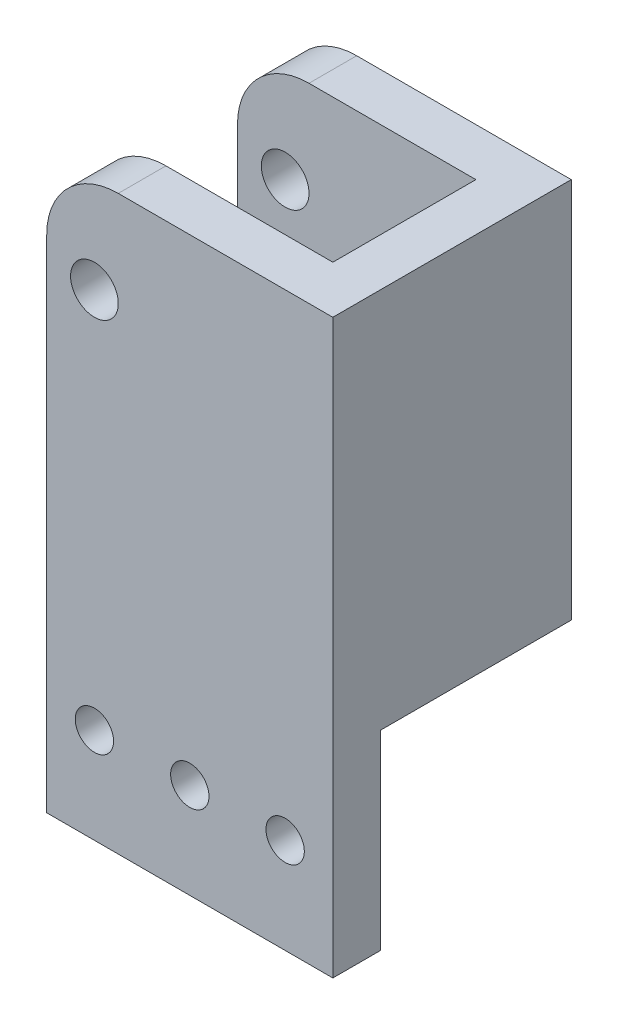
from build123d import *

# Parameters (mm, degrees)
SKETCH1_W                   = 38.1
SKETCH1_H                   = 76.2
BOSS_EXTRUDE1_DEPTH         = 31.75
SKETCH3_W                   = 25.4
SKETCH3_H                   = 76.2
CUT_EXTRUDE2_DEPTH          = 31.75
SKETCH4_W                   = 25.4
SKETCH4_H                   = 25.4
CUT_EXTRUDE3_DEPTH          = 89.44526556
SKETCH5_W                   = 31.75
SKETCH5_H                   = 6.35
BOSS_EXTRUDE2_DEPTH         = 50.8
SKETCH6_R                   = 3.175
CUT_EXTRUDE4_DEPTH          = 50.8
FILLET2_R                   = 9.525
SKETCH7_W                   = 31.75
SKETCH7_H                   = 19.05
BOSS_EXTRUDE3_DEPTH         = 6.35
F_1_4_20_TAPPED_HOLE1_D     = 5.1054
F_1_4_20_TAPPED_HOLE1_DEPTH = 19.05
F_1_4_20_TAPPED_HOLE1_TIP   = 1.533816902


with BuildPart() as part:
    # Sketch1 → Boss-Extrude1 (new body)
    with BuildSketch(Plane.XY):
        with Locations((19.05, 38.1)):
            Rectangle(SKETCH1_W, SKETCH1_H)
    extrude(amount=-BOSS_EXTRUDE1_DEPTH)

    # Sketch3 → Cut-Extrude2 (cut)
    with BuildSketch(Plane.ZY):
        with Locations((-19.05, 38.1)):
            Rectangle(SKETCH3_W, SKETCH3_H)
    extrude(amount=-CUT_EXTRUDE2_DEPTH, mode=Mode.SUBTRACT)

    # Sketch4 → Cut-Extrude3 (cut, through all)
    with BuildSketch(Plane.ZY.offset(-31.75)):
        with Locations((-19.05, 12.7)):
            Rectangle(SKETCH4_W, SKETCH4_H)
    extrude(amount=-CUT_EXTRUDE3_DEPTH, mode=Mode.SUBTRACT)

    # Sketch5 → Boss-Extrude2 (add)
    with BuildSketch(Plane(origin=(0, 76.2, 0), x_dir=(1, 0, 0), z_dir=(0, 1, 0))):
        with Locations((15.875, 28.575)):
            Rectangle(SKETCH5_W, SKETCH5_H)
    extrude(amount=-BOSS_EXTRUDE2_DEPTH)

    # Sketch6 → Cut-Extrude4 (cut)
    with BuildSketch(Plane(origin=(0, 0, -31.75), x_dir=(-1, 0, 0), z_dir=(0, 0, -1))):
        with Locations((-6.35, 63.5)):
            Circle(SKETCH6_R)
    extrude(amount=-CUT_EXTRUDE4_DEPTH, mode=Mode.SUBTRACT)

    # Fillet2
    fillet2_edges = [part.edges().sort_by_distance(p)[0] for p in [
        (0, 76.2, -3.175),
        (0, 76.2, -28.575),
    ]]
    fillet(fillet2_edges, radius=FILLET2_R)

    # Sketch7 → Boss-Extrude3 (add)
    with BuildSketch(Plane(origin=(0, 25.4, 0), x_dir=(-1, 0, 0), z_dir=(0, -1, 0))):
        with Locations((-15.875, 15.875)):
            Rectangle(SKETCH7_W, SKETCH7_H)
    extrude(amount=-BOSS_EXTRUDE3_DEPTH)

    # 1/4-20 Tapped Hole1
    with Locations(Plane(origin=(6.35, 12.7, 0), x_dir=(1, 0, 0), z_dir=(0, 0, 1))):
        with Locations((0, 0), (12.7, 0), (25.4, 0)):
            Hole(F_1_4_20_TAPPED_HOLE1_D / 2, depth=F_1_4_20_TAPPED_HOLE1_DEPTH)
            with Locations((0, 0, -(F_1_4_20_TAPPED_HOLE1_DEPTH + F_1_4_20_TAPPED_HOLE1_TIP / 2))):  # 118° drill point
                Cone(0, F_1_4_20_TAPPED_HOLE1_D / 2, F_1_4_20_TAPPED_HOLE1_TIP, mode=Mode.SUBTRACT)


solid = part.part
